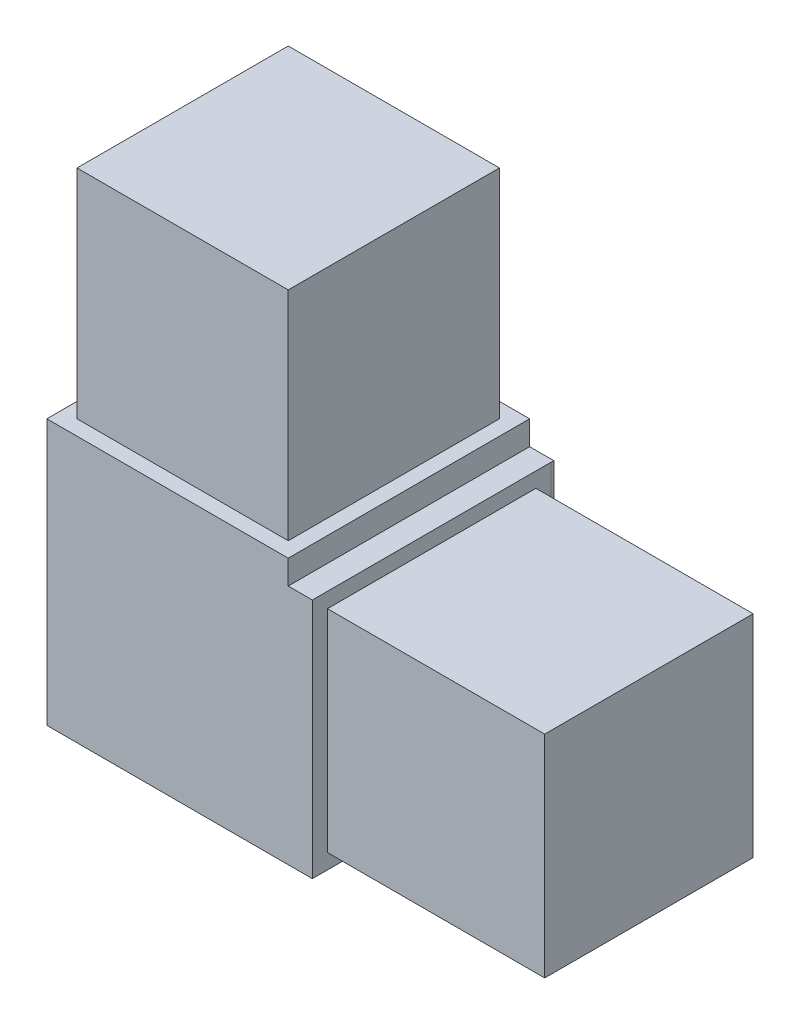
from build123d import *

# Parameters (mm, degrees)
SKETCH1_W           = 50.8
SKETCH1_H           = 50.8
BOSS_EXTRUDE1_DEPTH = 12.7
SKETCH2_W           = 25.4
SKETCH2_H           = 25.4
CUT_EXTRUDE1_DEPTH  = 44.994090512
SKETCH3_W           = 25.109814144
SKETCH3_H           = 25.4
SKETCH3_W_2         = 21.934814144
SKETCH3_H_2         = 22.225
CUT_EXTRUDE2_DEPTH  = 22.86
SKETCH5_W           = 25.4
SKETCH5_H           = 25.4
SKETCH5_W_2         = 22.225
SKETCH5_H_2         = 22.225
CUT_EXTRUDE4_DEPTH  = 22.86
CUT_EXTRUDE5_REACH  = 45.994
SKETCH6_W           = 22.835323581
SKETCH6_H           = 25.4


with BuildPart() as part:
    # Sketch1 → Boss-Extrude1 (new, symmetric)
    with BuildSketch(Plane.XY):
        Rectangle(SKETCH1_W, SKETCH1_H)
    extrude(amount=BOSS_EXTRUDE1_DEPTH, both=True)

    # Sketch2 → Cut-Extrude1 (cut, through all)
    with BuildSketch(Plane.XY.offset(12.7)):
        with Locations((12.7, 12.7)):
            Rectangle(SKETCH2_W, SKETCH2_H)
    extrude(amount=-CUT_EXTRUDE1_DEPTH, mode=Mode.SUBTRACT)

    # Sketch3 → Cut-Extrude2 (cut)
    with BuildSketch(Plane(origin=(25.4, 0, 0), x_dir=(0, 0, -1), z_dir=(1, 0, 0))):
        with Locations((-0.145092928, -12.7)):
            Rectangle(SKETCH3_W, SKETCH3_H)
        with Locations((-0.145092928, -12.7)):
            Rectangle(SKETCH3_W_2, SKETCH3_H_2, mode=Mode.SUBTRACT)
    extrude(amount=-CUT_EXTRUDE2_DEPTH, mode=Mode.SUBTRACT)

    # Sketch5 → Cut-Extrude4 (cut)
    with BuildSketch(Plane(origin=(0, 25.4, 0), x_dir=(1, 0, 0), z_dir=(0, 1, 0))):
        with Locations((-12.7, 0)):
            Rectangle(SKETCH5_W, SKETCH5_H)
        with Locations((-12.7, 0)):
            Rectangle(SKETCH5_W_2, SKETCH5_H_2, mode=Mode.SUBTRACT)
    extrude(amount=-CUT_EXTRUDE4_DEPTH, mode=Mode.SUBTRACT)

    # Sketch6 → Cut-Extrude5 (cut, up to next)
    with BuildSketch(Plane(origin=(0, 0, -12.7), x_dir=(-1, 0, 0), z_dir=(0, 0, -1)), mode=Mode.PRIVATE) as cut_extrude5_sk1:
        with Locations((-13.98233821, -12.7)):
            Rectangle(SKETCH6_W, SKETCH6_H)
    cut_extrude5_tool1 = extrude(cut_extrude5_sk1.sketch, amount=-CUT_EXTRUDE5_REACH, mode=Mode.PRIVATE) & part.part
    add(cut_extrude5_tool1.solids().sort_by_distance((13.982338, -12.7, -12.7))[0], mode=Mode.SUBTRACT)


solid = part.part
